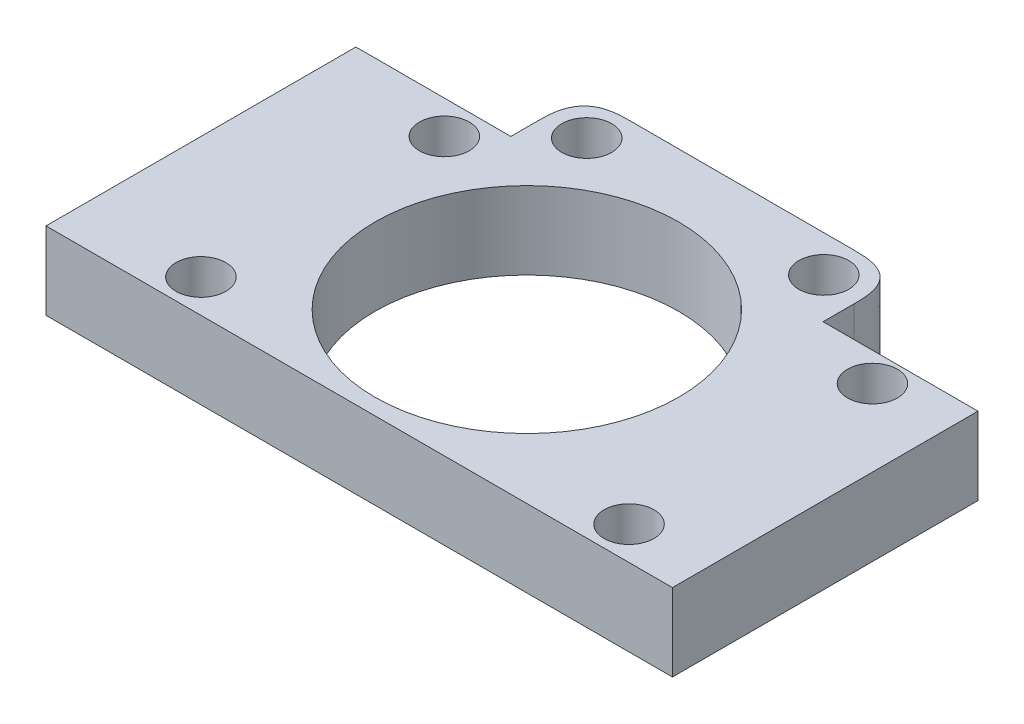
from build123d import *

# Parameters (mm, degrees)
CROQUIS1_R              = 9.8
CROQUIS1_R_2            = 1.61
CROQUIS1_R_3            = 1.610199264
CROQUIS1_R_4            = 1.610298895
SALIENTE_EXTRUIR3_DEPTH = 2.5
REDONDEO1_SIZE          = 3
REDONDEO2_SIZE          = 3


with BuildPart() as part:
    # Croquis1 → Saliente-Extruir3 (new, symmetric)
    with BuildSketch(Plane(origin=(0, 0, 0), x_dir=(1, 0, 0), z_dir=(0, 1, 0))):
        Polygon((-20.192989013, 7.194690523), (-10.192989013, 7.194690523), (-10.192989013, 11.914690523), (10.237010987, 11.914690523), (10.237010987, 6.914690523), (20.237010987, 6.914690523), (20.237010987, -12.805309477), (-20.192989013, -12.805309477), align=None)
        with Locations(Location((0, -1.965309477, 0), (0, 0, 270))):
            Circle(CROQUIS1_R, mode=Mode.SUBTRACT)
        with Locations(Location((-12.339891833, 5.049690523, 0), (0, 0, 270))):
            Circle(CROQUIS1_R_2, mode=Mode.SUBTRACT)
        with Locations(Location((-12.339891833, -10.660508741, 0), (0, 0, 270))):
            Circle(CROQUIS1_R_3, mode=Mode.SUBTRACT)
        with Locations(Location((15.290108167, 5.049690523, 0), (0, 0, 270))):
            Circle(CROQUIS1_R_2, mode=Mode.SUBTRACT)
        with Locations(Location((15.290108167, -10.660608373, 0), (0, 0, 270))):
            Circle(CROQUIS1_R_4, mode=Mode.SUBTRACT)
        with Locations(Location((-7.653762012, 9.553535498, 0), (0, 0, 270))):
            Circle(CROQUIS1_R_4, mode=Mode.SUBTRACT)
        with Locations(Location((7.645768396, 9.553535498, 0), (0, 0, 270))):
            Circle(CROQUIS1_R_4, mode=Mode.SUBTRACT)
    extrude(amount=SALIENTE_EXTRUIR3_DEPTH, both=True)

    # Redondeo1
    # a fillet whose section is not a circle: 3 mm, written as the material it takes off along each edge
    with BuildSketch(Plane(origin=(10.237010987, 10, -11.914690523), x_dir=(0, 0, 1), z_dir=(0, -1, 0))) as redondeo1_piece_1:
        with BuildLine():
            add(Edge.make_bspline([(REDONDEO1_SIZE, 0), (REDONDEO1_SIZE * 0.831801948466, 0), (REDONDEO1_SIZE * 0.663603896932, 0), (REDONDEO1_SIZE * 0.292893218813, REDONDEO1_SIZE * 0.0716919198361), (REDONDEO1_SIZE * 0.0716919198361, REDONDEO1_SIZE * 0.292893218813), (0, REDONDEO1_SIZE * 0.663603896932), (0, REDONDEO1_SIZE * 0.831801948466), (0, REDONDEO1_SIZE)], knots=[0, 0, 0, 0, 0, 0, 0.5, 0.5, 1, 1, 1, 1, 1, 1], degree=5))
            Line((0, REDONDEO1_SIZE), (0, 0))
            Line((0, 0), (REDONDEO1_SIZE, 0))
        make_face()
    extrude(amount=20, mode=Mode.SUBTRACT)

    # Redondeo2
    # a fillet whose section is not a circle: 3 mm, written as the material it takes off along each edge
    with BuildSketch(Plane(origin=(-10.192989013, 10, -11.914690523), x_dir=(0, 0, 1), z_dir=(0, -1, 0))) as redondeo2_piece_1:
        with BuildLine():
            add(Edge.make_bspline([(REDONDEO2_SIZE, 0), (REDONDEO2_SIZE * 0.831801948466, 0), (REDONDEO2_SIZE * 0.663603896932, 0), (REDONDEO2_SIZE * 0.292893218813, -REDONDEO2_SIZE * 0.0716919198361), (REDONDEO2_SIZE * 0.0716919198361, -REDONDEO2_SIZE * 0.292893218813), (0, -REDONDEO2_SIZE * 0.663603896932), (0, -REDONDEO2_SIZE * 0.831801948466), (0, -REDONDEO2_SIZE)], knots=[0, 0, 0, 0, 0, 0, 0.5, 0.5, 1, 1, 1, 1, 1, 1], degree=5))
            Line((0, -REDONDEO2_SIZE), (0, 0))
            Line((0, 0), (REDONDEO2_SIZE, 0))
        make_face()
    extrude(amount=20, mode=Mode.SUBTRACT)


solid = part.part
